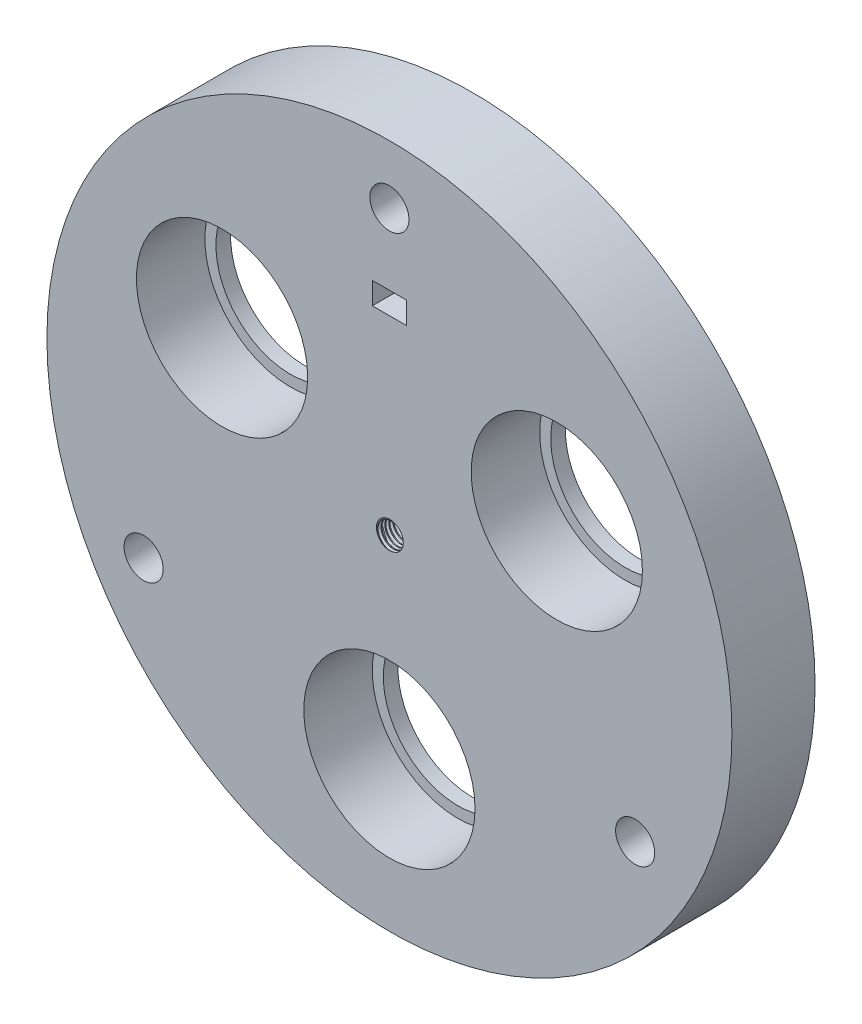
from build123d import *

# Parameters (mm, degrees)
ESBO_O1_R                  = 70
ESBO_O1_R_2                = 17.5
RESSALTO_EXTRUS_O1_DEPTH   = 17
ESBO_O15_R                 = 17.5
ESBO_O15_R_2               = 15.25
RESSALTO_EXTRUS_O5_DEPTH   = 3
CORTE_EXTRUS_O1_DEPTH      = 101.444014257
CORTE_EXTRUS_O1_DEPTH_BACK = 101.444014257
ESBO_O17_R                 = 4
CORTE_EXTRUS_O2_DEPTH      = 101.444014257
CORTE_EXTRUS_O2_DEPTH_BACK = 101.444014257
ESBO_O18_R                 = 3
ROSCA1_PITCH               = 0.8
ROSCA1_FROM                = 1
ROSCA1_TO                  = 18
CORTE_EXTRUS_O3_DEPTH      = 101.444014413
CORTE_EXTRUS_O3_DEPTH_BACK = 101.444014413
ESBO_O20_W                 = 7
ESBO_O20_H                 = 4.5


with BuildPart() as part:
    # Esboço1 → Ressalto-extrusão1 (new body)
    with BuildSketch(Plane.XY):
        Circle(ESBO_O1_R)
        with Locations((0, -39.5)):
            Circle(ESBO_O1_R_2, mode=Mode.SUBTRACT)
        with Locations((-34.208003449, 19.75)):
            Circle(ESBO_O1_R_2, mode=Mode.SUBTRACT)
        with Locations((34.208003449, 19.75)):
            Circle(ESBO_O1_R_2, mode=Mode.SUBTRACT)
    extrude(amount=RESSALTO_EXTRUS_O1_DEPTH)

    # Esboço15 → Ressalto-extrusão5 (add)
    # profile 1 of 3: a face of its own
    with BuildSketch(Plane.XY):
        with Locations((0, -39.5)):
            Circle(ESBO_O15_R)
        with Locations((0, -39.5)):
            Circle(ESBO_O15_R_2, mode=Mode.SUBTRACT)
    # profile 2 of 3: a face of its own
    with BuildSketch(Plane.XY):
        with Locations((-34.208003449, 19.75)):
            Circle(ESBO_O15_R)
        with Locations((-34.208003449, 19.75)):
            Circle(ESBO_O15_R_2, mode=Mode.SUBTRACT)
    # profile 3 of 3: a face of its own
    with BuildSketch(Plane.XY):
        with Locations((34.208003449, 19.75)):
            Circle(ESBO_O15_R)
        with Locations((34.208003449, 19.75)):
            Circle(ESBO_O15_R_2, mode=Mode.SUBTRACT)
    extrude(amount=RESSALTO_EXTRUS_O5_DEPTH)

    # Esboço17 → Corte-extrusão1 (cut, two sides: drawn at the far end of the back side and taken through both)
    with BuildSketch(Plane(origin=(0, 0, 0), x_dir=(-1, 0, 0), z_dir=(0, 0, -1)).offset(-CORTE_EXTRUS_O1_DEPTH_BACK)):
        with Locations((0, 58)):
            Circle(ESBO_O17_R)
        with Locations((50.229473419, -29)):
            Circle(ESBO_O17_R)
        with Locations((-50.229473419, -29)):
            Circle(ESBO_O17_R)
    extrude(amount=CORTE_EXTRUS_O1_DEPTH + CORTE_EXTRUS_O1_DEPTH_BACK, mode=Mode.SUBTRACT)

    # Esboço18 → Corte-extrusão2 (cut, two sides: drawn at the far end of the back side and taken through both)
    with BuildSketch(Plane.XY.offset(17).offset(-CORTE_EXTRUS_O2_DEPTH_BACK)):
        Circle(ESBO_O18_R)
    extrude(amount=CORTE_EXTRUS_O2_DEPTH + CORTE_EXTRUS_O2_DEPTH_BACK, mode=Mode.SUBTRACT)

    # Rosca1: arcs per turn and ends read off the stored shape
    # Rosca1: the profile of Perfil da rosca1 profile screwed along a right-hand helix through 22.5 turns, 8 arcs to a turn; built about Z, then put on its axis
    rosca1_z = Axis((0, 0, 0), (0, 0, 1))
    rosca1_corners = [(3.0003, 0, -0.000173205), (3.0003, 0, 0.700173203), (2.5669873, 0, 0.449999999), (2.5669873, 0, 0.249999999)]
    with BuildLine(mode=Mode.PRIVATE) as rosca1_profile:
        Line(rosca1_corners[0], rosca1_corners[1])
        Line(rosca1_corners[1], rosca1_corners[2])
        Line(rosca1_corners[2], rosca1_corners[3])
        Line(rosca1_corners[3], rosca1_corners[0])
    rosca1_cap = Face(rosca1_profile.wire())
    rosca1_turn_angles = [0, 22.5, 45, 67.5, 90, 112.5, 135, 157.5, 180, 202.5, 225, 247.5, 270, 292.5, 315, 337.5, 360]
    rosca1_turn_weights = [1, 0.9238795325112867, 1, 0.9238795325112867, 1, 0.9238795325112867, 1, 0.9238795325112867, 1, 0.9238795325112867, 1, 0.9238795325112867, 1, 0.9238795325112867, 1, 0.9238795325112867, 1]
    rosca1_turn_rails = [Edge.make_bspline([Vector(p[0], p[1], 0).rotate(rosca1_z, rosca1_turn_angles[k]) / rosca1_turn_weights[k] + Vector(0, 0, p[2] + ROSCA1_PITCH * rosca1_turn_angles[k] / 360) for k in range(17)], [0, 0, 0, 1, 1, 2, 2, 3, 3, 4, 4, 5, 5, 6, 6, 7, 7, 8, 8, 8], 2, rosca1_turn_weights) for p in rosca1_corners]
    rosca1_turn_sides = [Face.make_surface_from_curves(rosca1_turn_rails[p[0]], rosca1_turn_rails[p[1]]) for p in [(0, 1), (1, 2), (2, 3), (3, 0)]]
    rosca1_last_angles = [7920, 7942.5, 7965, 7987.5, 8010, 8032.5, 8055, 8077.5, 8100]
    rosca1_last_weights = [1, 0.9238795325112867, 1, 0.9238795325112867, 1, 0.9238795325112867, 1, 0.9238795325112837, 1]
    rosca1_last_rails = [Edge.make_bspline([Vector(p[0], p[1], 0).rotate(rosca1_z, rosca1_last_angles[k]) / rosca1_last_weights[k] + Vector(0, 0, p[2] + ROSCA1_PITCH * rosca1_last_angles[k] / 360) for k in range(9)], [0, 0, 0, 1, 1, 2, 2, 3, 3, 4, 4, 4], 2, rosca1_last_weights) for p in rosca1_corners]
    rosca1_last_sides = [Face.make_surface_from_curves(rosca1_last_rails[p[0]], rosca1_last_rails[p[1]]) for p in [(0, 1), (1, 2), (2, 3), (3, 0)]]
    rosca1 = Plane(origin=(0, 0, 18), x_dir=(-1, 0, 0), z_dir=(0, 0, -1)) * split(split(Solid(Shell([*[p.moved(Location((0, 0, ROSCA1_PITCH * i))) for i in range(22) for p in rosca1_turn_sides], *rosca1_last_sides, rosca1_cap, rosca1_cap.rotate(rosca1_z, 8100).moved(Location((0, 0, ROSCA1_PITCH * 8100 / 360)))])), bisect_by=Plane.XY.offset(ROSCA1_FROM), keep=Keep.TOP, mode=Mode.PRIVATE), bisect_by=Plane.XY.offset(ROSCA1_TO), keep=Keep.BOTTOM, mode=Mode.PRIVATE)
    add(rosca1)

    # Esboço20 → Corte-extrusão3 (cut, two sides: drawn at the far end of the back side and taken through both)
    with BuildSketch(Plane.XY.offset(17).offset(-CORTE_EXTRUS_O3_DEPTH_BACK)):
        with Locations((0, 41.25)):
            Rectangle(ESBO_O20_W, ESBO_O20_H)
    extrude(amount=CORTE_EXTRUS_O3_DEPTH + CORTE_EXTRUS_O3_DEPTH_BACK, mode=Mode.SUBTRACT)


solid = part.part
